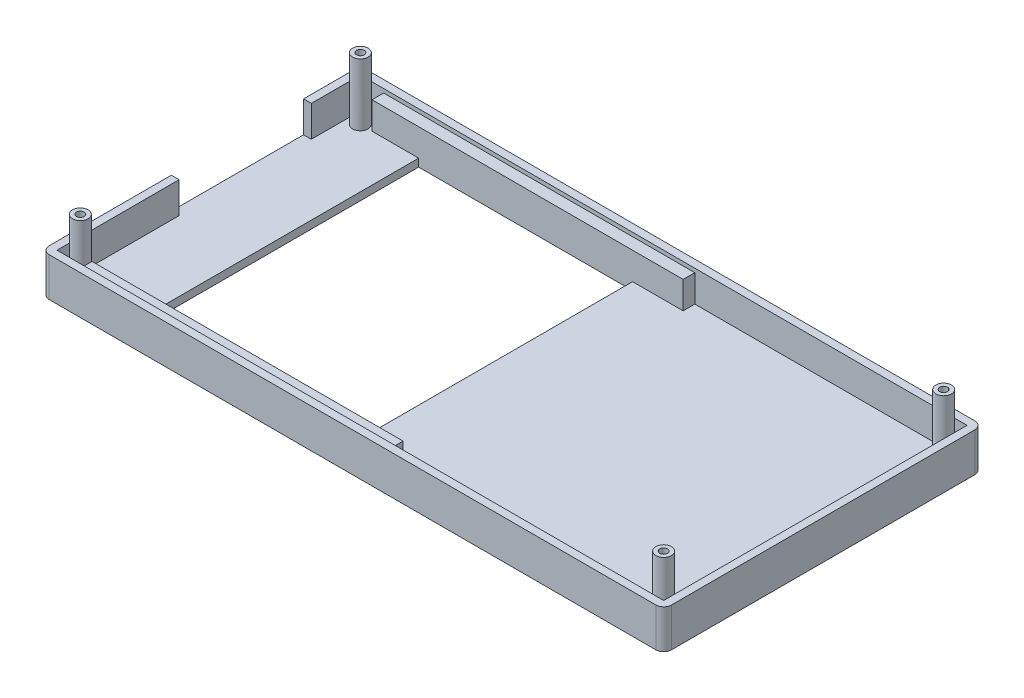
from build123d import *

# Parameters (mm, degrees)
SKETCH1_W           = 160
SKETCH1_H           = 82
BOSS_EXTRUDE1_DEPTH = 10
SHELL1_T            = -2
FILLET1_R           = 2
FILLET2_R           = 2
FILLET3_R           = 2
FILLET4_R           = 2
SKETCH10_W          = 34
SKETCH10_H          = 8.029729716
CUT_EXTRUDE1_DEPTH  = 6
SKETCH2_R           = 2
SKETCH2_R_2         = 1
BOSS_EXTRUDE7_DEPTH = 16
SKETCH12_W          = 80
SKETCH12_H          = 3
BOSS_EXTRUDE8_DEPTH = 7
SKETCH13_W          = 55
SKETCH13_H          = 72
CUT_EXTRUDE3_DEPTH  = 200


with BuildPart() as part:
    # Sketch1 → Boss-Extrude1 (new body)
    with BuildSketch(Plane(origin=(0, 0, 0), x_dir=(1, 0, 0), z_dir=(0, 1, 0))):
        Rectangle(SKETCH1_W, SKETCH1_H)
    extrude(amount=BOSS_EXTRUDE1_DEPTH)

    # Shell1
    shell1_openings = [part.faces().sort_by_distance(p)[0] for p in [
        (0, 10, 0),
    ]]
    offset(amount=SHELL1_T, openings=shell1_openings, kind=Kind.INTERSECTION)

    # Fillet1
    fillet1_edges = [part.edges().sort_by_distance(p)[0] for p in [
        (-80, 5, 41),
    ]]
    fillet(fillet1_edges, radius=FILLET1_R)

    # Fillet2
    fillet2_edges = [part.edges().sort_by_distance(p)[0] for p in [
        (-80, 5, -41),
    ]]
    fillet(fillet2_edges, radius=FILLET2_R)

    # Fillet3
    fillet3_edges = [part.edges().sort_by_distance(p)[0] for p in [
        (80, 5, -41),
    ]]
    fillet(fillet3_edges, radius=FILLET3_R)

    # Fillet4
    fillet4_edges = [part.edges().sort_by_distance(p)[0] for p in [
        (80, 5, 41),
    ]]
    fillet(fillet4_edges, radius=FILLET4_R)

    # Sketch10 → Cut-Extrude1 (cut)
    with BuildSketch(Plane.ZY.offset(80)):
        with Locations((-9.4, 6.014864858)):
            Rectangle(SKETCH10_W, SKETCH10_H)
    extrude(amount=-CUT_EXTRUDE1_DEPTH, mode=Mode.SUBTRACT)

    # Sketch2 → Boss-Extrude7 (add)
    # profile 1 of 4: a face of its own
    with BuildSketch(Plane(origin=(0, 2, 0), x_dir=(1, 0, 0), z_dir=(0, 1, 0))):
        with Locations((-75, 36)):
            Circle(SKETCH2_R)
        with Locations((-75, 36)):
            Circle(SKETCH2_R_2, mode=Mode.SUBTRACT)
    # profile 2 of 4: a face of its own
    with BuildSketch(Plane(origin=(0, 2, 0), x_dir=(1, 0, 0), z_dir=(0, 1, 0))):
        with Locations((75, 36)):
            Circle(SKETCH2_R)
        with Locations((75, 36)):
            Circle(SKETCH2_R_2, mode=Mode.SUBTRACT)
    # profile 3 of 4: a face of its own
    with BuildSketch(Plane(origin=(0, 2, 0), x_dir=(1, 0, 0), z_dir=(0, 1, 0))):
        with Locations((-75, -36)):
            Circle(SKETCH2_R)
        with Locations((-75, -36)):
            Circle(SKETCH2_R_2, mode=Mode.SUBTRACT)
    # profile 4 of 4: a face of its own
    with BuildSketch(Plane(origin=(0, 2, 0), x_dir=(1, 0, 0), z_dir=(0, 1, 0))):
        with Locations((75, -36)):
            Circle(SKETCH2_R)
        with Locations((75, -36)):
            Circle(SKETCH2_R_2, mode=Mode.SUBTRACT)
    extrude(amount=BOSS_EXTRUDE7_DEPTH)

    # Sketch12 → Boss-Extrude8 (add)
    with BuildSketch(Plane(origin=(0, 2, 0), x_dir=(1, 0, 0), z_dir=(0, 1, 0))):
        with Locations((-32, 37.5)):
            Rectangle(SKETCH12_W, SKETCH12_H)
        with Locations((-32, -37.5)):
            Rectangle(SKETCH12_W, SKETCH12_H)
    extrude(amount=BOSS_EXTRUDE8_DEPTH)

    # Sketch13 → Cut-Extrude3 (cut)
    with BuildSketch(Plane(origin=(0, 2, 0), x_dir=(1, 0, 0), z_dir=(0, 1, 0))):
        with Locations((-32.5, 0)):
            Rectangle(SKETCH13_W, SKETCH13_H)
    extrude(amount=-CUT_EXTRUDE3_DEPTH, mode=Mode.SUBTRACT)


solid = part.part
